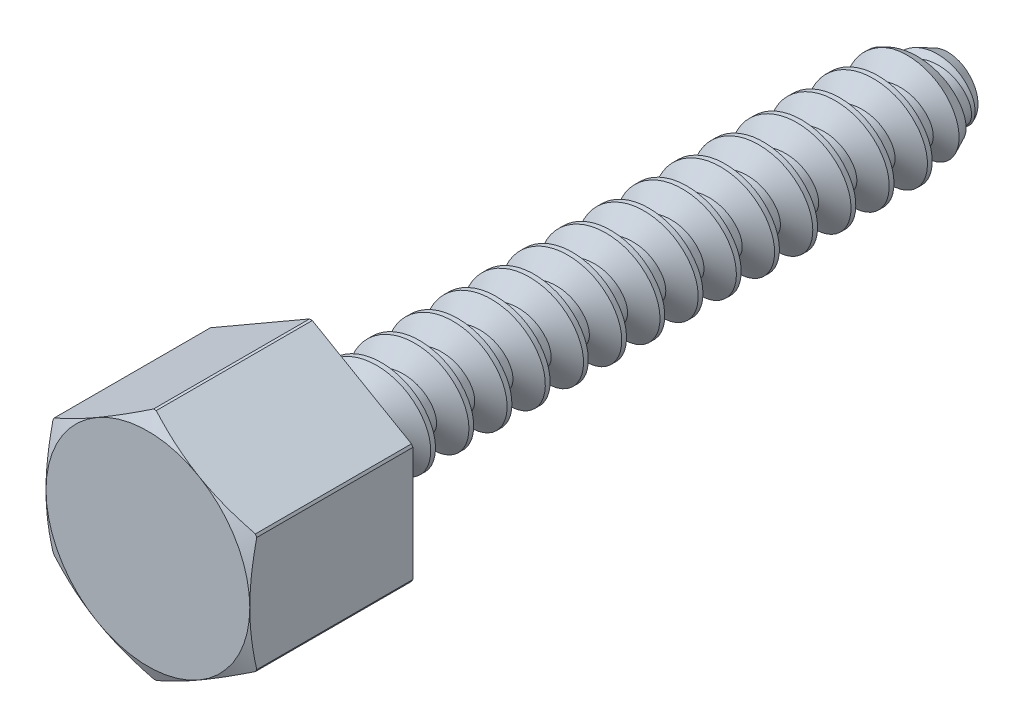
from build123d import *

# Parameters (mm, degrees)
SKETCH1_W        = 25
SKETCH1_H        = 2
CUT_SWEEP1_PITCH = 1.5
EXTRUDE1_DEPTH   = 6.4


with BuildPart() as part:
    # Sketch1 → Revolve1 (revolve)
    with BuildSketch(Plane(origin=(0, 0, 0), x_dir=(0, 0, -1), z_dir=(1, 0, 0))):
        with Locations((12.5, 1)):
            Rectangle(SKETCH1_W, SKETCH1_H)
    revolve(axis=Axis((0, 0, 0), (0, 0, 1)))

    # Cut-Sweep1: the profile of Sketch2 screwed along a right-hand helix of 20 turns, 8 arcs to a turn; built about Z, then put on its axis
    cut_sweep1_z = Axis((0, 0, 0), (0, 0, 1))
    cut_sweep1_corners = [(2, 0, -1.3125), (1.188101184, 0, -0.84375), (1.188101184, 0, -0.46875), (2.162379763, 0, 0.09375)]
    with BuildLine(mode=Mode.PRIVATE) as cut_sweep1_profile:
        Line(cut_sweep1_corners[0], cut_sweep1_corners[1])
        Line(cut_sweep1_corners[1], cut_sweep1_corners[2])
        Line(cut_sweep1_corners[2], cut_sweep1_corners[3])
        Line(cut_sweep1_corners[3], cut_sweep1_corners[0])
    cut_sweep1_cap = Face(cut_sweep1_profile.wire())
    cut_sweep1_turn_angles = [0, 22.5, 45, 67.5, 90, 112.5, 135, 157.5, 180, 202.5, 225, 247.5, 270, 292.5, 315, 337.5, 360]
    cut_sweep1_turn_weights = [1, 0.9238795325112867, 1, 0.9238795325112867, 1, 0.9238795325112867, 1, 0.9238795325112867, 1, 0.9238795325112867, 1, 0.9238795325112867, 1, 0.9238795325112867, 1, 0.9238795325112867, 1]
    cut_sweep1_turn_rails = [Edge.make_bspline([Vector(p[0], p[1], 0).rotate(cut_sweep1_z, cut_sweep1_turn_angles[k]) / cut_sweep1_turn_weights[k] + Vector(0, 0, p[2] + CUT_SWEEP1_PITCH * cut_sweep1_turn_angles[k] / 360) for k in range(17)], [0, 0, 0, 1, 1, 2, 2, 3, 3, 4, 4, 5, 5, 6, 6, 7, 7, 8, 8, 8], 2, cut_sweep1_turn_weights) for p in cut_sweep1_corners]
    cut_sweep1_turn_sides = [Face.make_surface_from_curves(cut_sweep1_turn_rails[p[0]], cut_sweep1_turn_rails[p[1]]) for p in [(0, 1), (1, 2), (2, 3), (3, 0)]]
    cut_sweep1 = Plane(origin=(0, 0, -25), x_dir=(0, 1, 0), z_dir=(0, 0, 1)) * Solid(Shell([*[p.moved(Location((0, 0, CUT_SWEEP1_PITCH * i))) for i in range(20) for p in cut_sweep1_turn_sides], cut_sweep1_cap, cut_sweep1_cap.rotate(cut_sweep1_z, 7200).moved(Location((0, 0, CUT_SWEEP1_PITCH * 7200 / 360)))]))
    add(cut_sweep1, mode=Mode.SUBTRACT)

    # Sketch3 → Cut-Revolve2 (revolve, cut)
    with BuildSketch(Plane(origin=(0, 0, 0), x_dir=(0, 0, -1), z_dir=(1, 0, 0))):
        Polygon((25, 1.188101184), (23.25887737, 2), (25, 2), align=None)
    revolve(axis=Axis((0, 0, -23.25887737), (0, 0, 1)), mode=Mode.SUBTRACT)

    # Sketch4 → Extrude1 (add)
    with BuildSketch(Plane.XY):
        Polygon((0, 4.618802154), (-4, 2.309401077), (-4, -2.309401077), (0, -4.618802154), (4, -2.309401077), (4, 2.309401077), align=None)
    extrude(amount=EXTRUDE1_DEPTH)

    # Sketch5 → Cut-Revolve3 (revolve, cut)
    with BuildSketch(Plane(origin=(0, 0, 0), x_dir=(0, 0, -1), z_dir=(1, 0, 0))):
        Polygon((-6.4, 4), (-6.125875426, 4.587862046), (0, 4.587862046), (0, 4.618802154), (-6.4, 4.618802154), align=None)
    revolve(axis=Axis((0, 0, 0), (0, 0, 1)), mode=Mode.SUBTRACT)


solid = part.part
